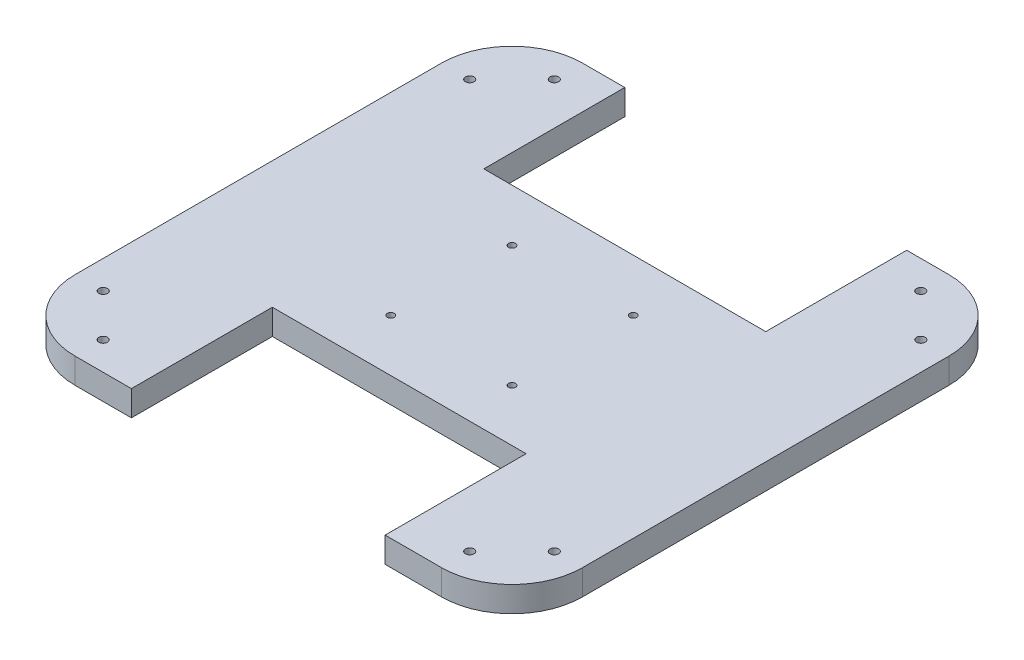
from build123d import *

# Parameters (mm, degrees)
PLATE_DEPTH        = 9
SKETCH3_R          = 1.525
HEX_HOLES_DEPTH    = 128.597021909
SKETCH4_R          = 1.25
LIDAR_HOLES_DEPTH  = 128.597021909
SKETCH5_W          = 100
SKETCH5_H          = 50
SKETCH5_W_2        = 90
CUT_EXTRUDE1_DEPTH = 128.597021909


with BuildPart() as part:
    # Sketch1 → Plate (new body)
    with BuildSketch(Plane(origin=(0, 0, 0), x_dir=(1, 0, 0), z_dir=(0, 1, 0))):
        with BuildLine():
            Line((-65, -90), (65, -90))
            ThreePointArc((65, -90), (82.67766953, -82.67766953), (90, -65))
            Line((90, -65), (90, 65))
            ThreePointArc((90, 65), (82.67766953, 82.67766953), (65, 90))
            Line((65, 90), (-65, 90))
            ThreePointArc((-65, 90), (-82.67766953, 82.67766953), (-90, 65))
            Line((-90, 65), (-90, -65))
            ThreePointArc((-90, -65), (-82.67766953, -82.67766953), (-65, -90))
        make_face()
    extrude(amount=PLATE_DEPTH)

    # Sketch3 → Hex Holes (cut, through all)
    with BuildSketch(Plane(origin=(0, 9, 0), x_dir=(1, 0, 0), z_dir=(0, 1, 0))):
        with Locations((-65, 80)):
            Circle(SKETCH3_R)
        with Locations((-80, 65)):
            Circle(SKETCH3_R)
        with Locations((80, 65)):
            Circle(SKETCH3_R)
        with Locations((80, -65)):
            Circle(SKETCH3_R)
        with Locations((65, 80)):
            Circle(SKETCH3_R)
        with Locations((65, -80)):
            Circle(SKETCH3_R)
        with Locations((-65, -80)):
            Circle(SKETCH3_R)
        with Locations((-80, -65)):
            Circle(SKETCH3_R)
    extrude(amount=-HEX_HOLES_DEPTH, mode=Mode.SUBTRACT)

    # Sketch4 → LiDAR Holes (cut, through all)
    with BuildSketch(Plane(origin=(0, 9, 0), x_dir=(1, 0, 0), z_dir=(0, 1, 0))):
        with Locations((-21.5, 21.5)):
            Circle(SKETCH4_R)
        with Locations((21.5, 21.5)):
            Circle(SKETCH4_R)
        with Locations((21.5, -21.5)):
            Circle(SKETCH4_R)
        with Locations((-21.5, -21.5)):
            Circle(SKETCH4_R)
    extrude(amount=-LIDAR_HOLES_DEPTH, mode=Mode.SUBTRACT)

    # Sketch5 → Cut-Extrude1 (cut, through all)
    with BuildSketch(Plane(origin=(0, 9, 0), x_dir=(1, 0, 0), z_dir=(0, 1, 0))):
        with Locations((0, 65)):
            Rectangle(SKETCH5_W, SKETCH5_H)
        with Locations((0, -65)):
            Rectangle(SKETCH5_W_2, SKETCH5_H)
    extrude(amount=-CUT_EXTRUDE1_DEPTH, mode=Mode.SUBTRACT)


solid = part.part
